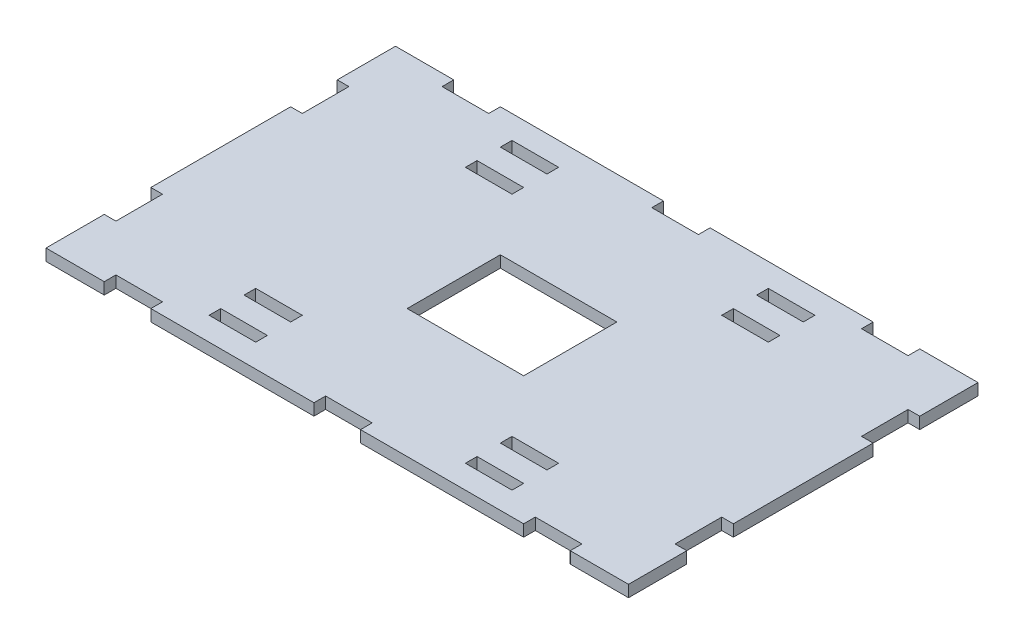
from build123d import *

# Parameters (mm, degrees)
SKETCH1_W           = 20
SKETCH1_H           = 5
SKETCH1_W_2         = 50
SKETCH1_H_2         = 40
BOSS_EXTRUDE1_DEPTH = 5


with BuildPart() as part:
    # Sketch1 → Boss-Extrude1 (new body)
    with BuildSketch(Plane(origin=(0, 0, 0), x_dir=(1, 0, 0), z_dir=(0, 1, 0))):
        Polygon((-125, 75), (-100, 75), (-100, 70), (-80, 70), (-80, 75), (-10, 75), (-10, 70), (10, 70), (10, 75), (80, 75), (80, 70), (100, 70), (100, 75), (125, 75), (125, 50), (120, 50), (120, 30), (125, 30), (125, -30), (120, -30), (120, -50), (125, -50), (125, -75), (100, -75), (100, -70), (80, -70), (80, -75), (10, -75), (10, -70), (-10, -70), (-10, -75), (-80, -75), (-80, -70), (-100, -70), (-100, -75), (-125, -75), (-125, -50), (-120, -50), (-120, -30), (-125, -30), (-125, 30), (-120, 30), (-120, 50), (-125, 50), align=None)
        with Locations((-55, -47.5)):
            Rectangle(SKETCH1_W, SKETCH1_H, mode=Mode.SUBTRACT)
        with Locations((-55, -62.5)):
            Rectangle(SKETCH1_W, SKETCH1_H, mode=Mode.SUBTRACT)
        Rectangle(SKETCH1_W_2, SKETCH1_H_2, mode=Mode.SUBTRACT)
        with Locations((55, -62.5)):
            Rectangle(SKETCH1_W, SKETCH1_H, mode=Mode.SUBTRACT)
        with Locations((55, -47.5)):
            Rectangle(SKETCH1_W, SKETCH1_H, mode=Mode.SUBTRACT)
        with Locations((55, 47.5)):
            Rectangle(SKETCH1_W, SKETCH1_H, mode=Mode.SUBTRACT)
        with Locations((55, 62.5)):
            Rectangle(SKETCH1_W, SKETCH1_H, mode=Mode.SUBTRACT)
        with Locations((-55, 62.5)):
            Rectangle(SKETCH1_W, SKETCH1_H, mode=Mode.SUBTRACT)
        with Locations((-55, 47.5)):
            Rectangle(SKETCH1_W, SKETCH1_H, mode=Mode.SUBTRACT)
    extrude(amount=BOSS_EXTRUDE1_DEPTH)


solid = part.part
